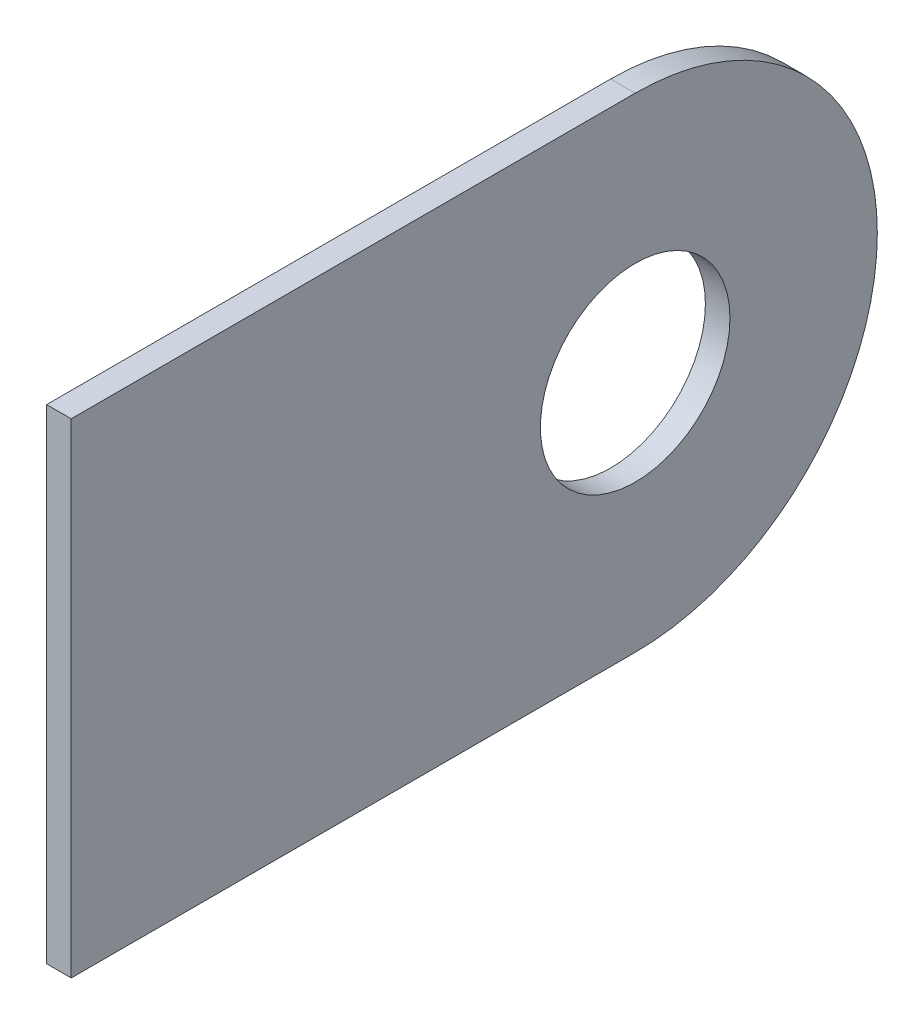
from build123d import *

# Parameters (mm, degrees)
SKETCH1_R          = 9.65
BASE_FLANGE1_DEPTH = 2.5
SCALE1_SCALE       = 1.5


# Sheet-metal steps are written as plain solids
with BuildPart() as part:
    # Sketch1 → Base-Flange1 (new body)
    with BuildSketch(Plane(origin=(0, 0, 0), x_dir=(0, 0, -1), z_dir=(1, 0, 0))):
        with BuildLine():
            Line((0, 24.65), (-57.40704, 24.65))
            Line((-57.40704, 24.65), (-57.40704, -24.65))
            Line((-57.40704, -24.65), (0, -24.65))
            ThreePointArc((0, -24.65), (24.65, 0), (0, 24.65))
        make_face()
        Circle(SKETCH1_R, mode=Mode.SUBTRACT)
    extrude(amount=-BASE_FLANGE1_DEPTH)


with BuildPart() as part_1:
    # Scale1: scaled about (-1.25, 0, 20.403540004)
    add(part.part.scale(SCALE1_SCALE).moved(Location((0.625, 0, -10.201770002))))


solid = part_1.part
